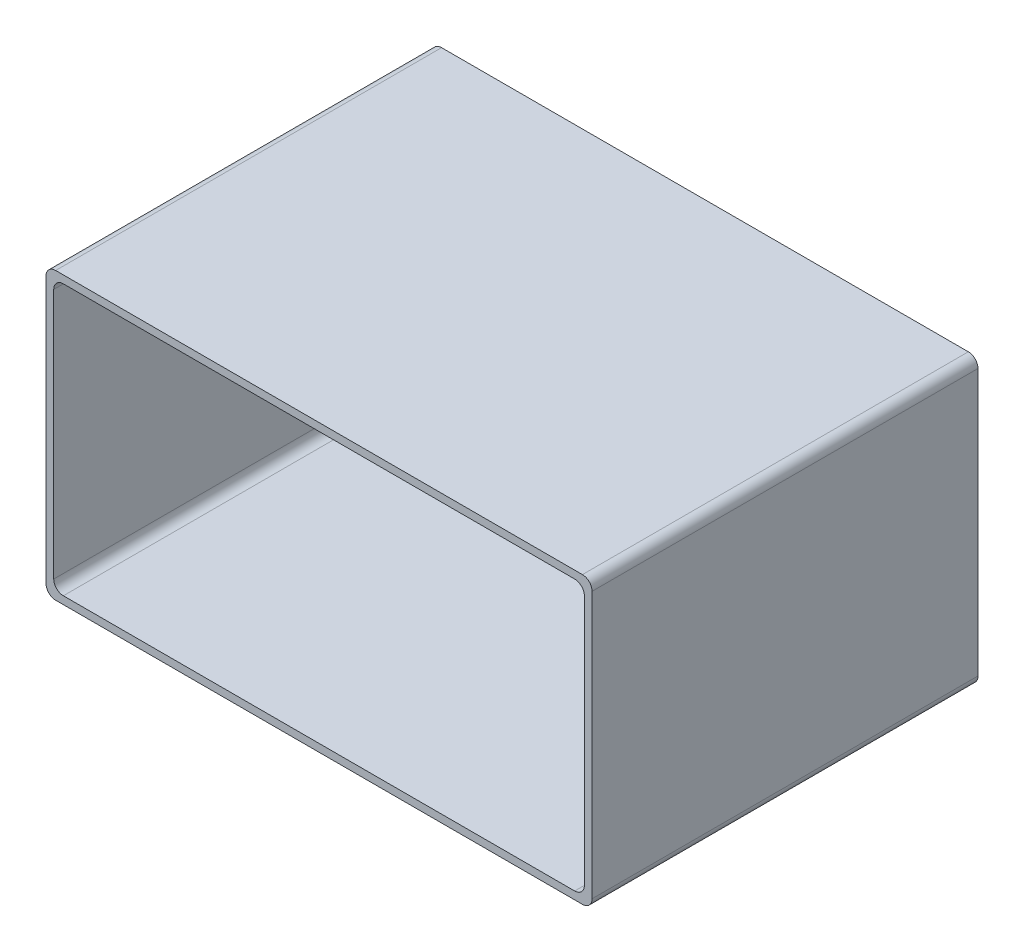
from build123d import *

# Parameters (mm, degrees)
ESQUISSE1_W        = 56.6
ESQUISSE1_H        = 29.6
ESQUISSE1_W_2      = 55
ESQUISSE1_H_2      = 28
BOSS_EXTRU_1_DEPTH = 40
CONG_1_R           = 1


with BuildPart() as part:
    # Esquisse1 → Boss.-Extru.1 (new body)
    with BuildSketch(Plane.XY):
        Rectangle(ESQUISSE1_W, ESQUISSE1_H)
        Rectangle(ESQUISSE1_W_2, ESQUISSE1_H_2, mode=Mode.SUBTRACT)
    extrude(amount=BOSS_EXTRU_1_DEPTH)

    # Congé1
    cong_1_edges = [part.edges().sort_by_distance(p)[0] for p in [
        (-27.5, 14, 20),
        (-27.5, -14, 20),
        (27.5, -14, 20),
        (27.5, 14, 20),
        (28.3, -14.8, 20),
        (-28.3, -14.8, 20),
        (-28.3, 14.8, 20),
        (28.3, 14.8, 20),
    ]]
    fillet(cong_1_edges, radius=CONG_1_R)


solid = part.part
